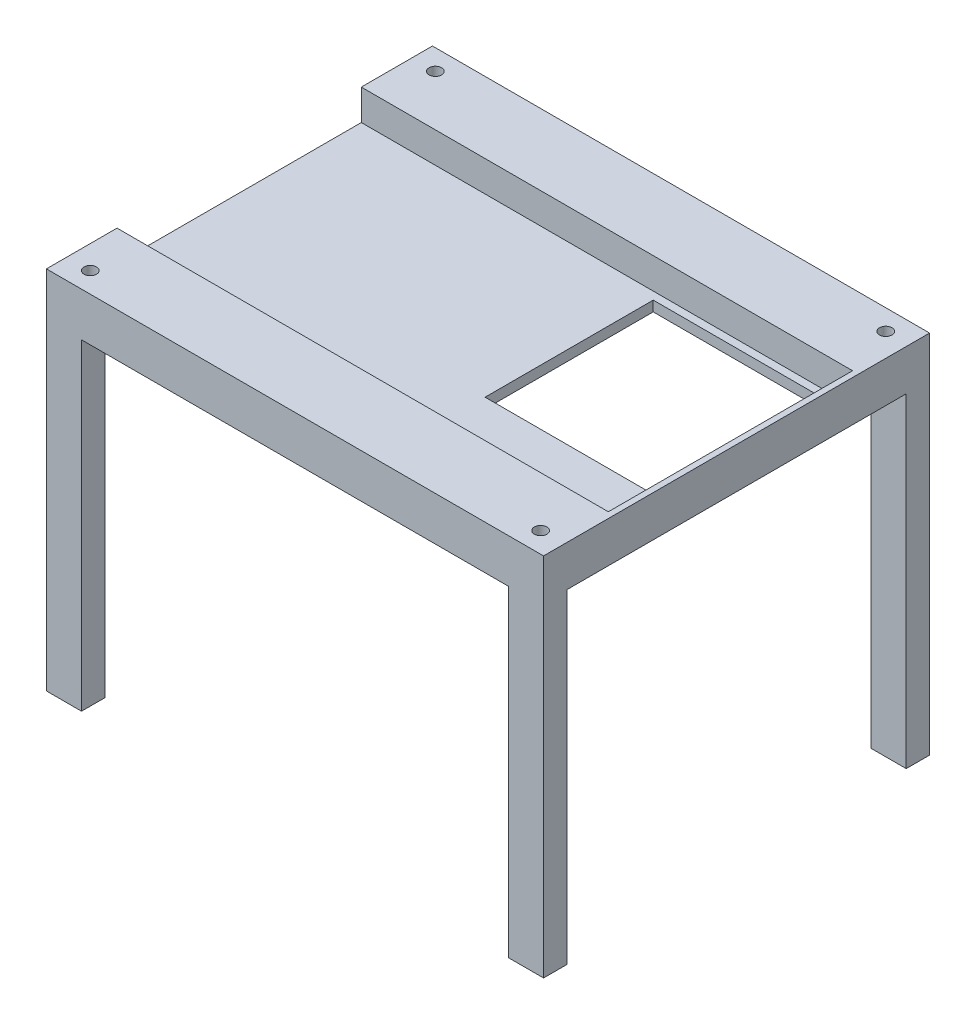
from build123d import *

# Parameters (mm, degrees)
SKETCH1_9_W                                = 170
SKETCH1_9_H                                = 87
BOSS_EXTRUDE5_DEPTH                        = 2
SKETCH1_10_W                               = 63
SKETCH1_10_H                               = 78
CUT_EXTRUDE3_DEPTH                         = 9
SKETCH1_12_W                               = 170
SKETCH1_12_H                               = 87
BOSS_EXTRUDE6_DEPTH                        = 14
SKETCH1_W                                  = 63
SKETCH1_H                                  = 78
CUT_EXTRUDE4_DEPTH                         = 29
SKETCH8_W                                  = 83.526029731
SKETCH8_H                                  = 10.5
CUT_EXTRUDE5_DEPTH                         = 168
BOSS_EXTRUDE10_DEPTH                       = 22.5
CHAMFER1_SIZE                              = 10
CHAMFER2_SIZE                              = 10
SKETCH47_R                                 = 2.15
CUT_EXTRUDE10_DEPTH                        = 9.5
SKETCH37_W                                 = 170
SKETCH37_H                                 = 9
BOSS_EXTRUDE20_DEPTH                       = 5
SKETCH25_W                                 = 170
SKETCH25_H                                 = 8
BOSS_EXTRUDE18_DEPTH                       = 120
SKETCH28_W                                 = 170
SKETCH28_H                                 = 8
BOSS_EXTRUDE19_DEPTH                       = 120
SKETCH43_W                                 = 146
SKETCH43_H                                 = 110
CUT_EXTRUDE9_DEPTH                         = 170.5
SKETCH42_W                                 = 63
SKETCH42_H                                 = 3.5
BOSS_EXTRUDE22_DEPTH                       = 20.5
SKETCH38_W                                 = 5
SKETCH38_H                                 = 9
BOSS_EXTRUDE23_DEPTH                       = 9.5
MIRROR14_AT_THE_SECOND_PLANE_COPY_1_SKET_W = 5
MIRROR14_AT_THE_SECOND_PLANE_COPY_1_SKET_H = 9
MIRROR14_AT_THE_SECOND_PLANE_COPY_1_DEPTH  = 9.5


with BuildPart() as part:
    # Sketch1<9> → Boss-Extrude5 (new body)
    with BuildSketch(Plane(origin=(0, 0, 0), x_dir=(1, 0, 0), z_dir=(0, 1, 0))):
        with Locations((82.5, 41)):
            Rectangle(SKETCH1_9_W, SKETCH1_9_H)
    extrude(amount=BOSS_EXTRUDE5_DEPTH)

    # Sketch1<10> → Cut-Extrude3 (cut)
    with BuildSketch(Plane(origin=(0, 0, 0), x_dir=(1, 0, 0), z_dir=(0, 1, 0))):
        with Locations((131.5, 41)):
            Rectangle(SKETCH1_10_W, SKETCH1_10_H)
    extrude(amount=CUT_EXTRUDE3_DEPTH, mode=Mode.SUBTRACT)

    # Sketch1<12> → Boss-Extrude6 (add)
    with BuildSketch(Plane(origin=(0, 0, 0), x_dir=(1, 0, 0), z_dir=(0, 1, 0))):
        with Locations((82.5, 41)):
            Rectangle(SKETCH1_12_W, SKETCH1_12_H)
    extrude(amount=BOSS_EXTRUDE6_DEPTH)

    # Sketch1 → Cut-Extrude4 (cut)
    with BuildSketch(Plane(origin=(0, 0, 0), x_dir=(1, 0, 0), z_dir=(0, 1, 0))):
        with Locations((131.5, 41)):
            Rectangle(SKETCH1_W, SKETCH1_H)
    extrude(amount=CUT_EXTRUDE4_DEPTH, mode=Mode.SUBTRACT)

    # Sketch8 → Cut-Extrude5 (cut)
    with BuildSketch(Plane.ZY.offset(2.5)):
        with Locations((-40.910699185, 8.75)):
            Rectangle(SKETCH8_W, SKETCH8_H)
    extrude(amount=-CUT_EXTRUDE5_DEPTH, mode=Mode.SUBTRACT)

    # Sketch11 → Boss-Extrude10 (add)
    with BuildSketch(Plane.XY.offset(2.5)):
        Polygon((-2.5, 14), (90, 14), (167.5, 14), (167.5, 9), (90, 9), (-2.5, 9), align=None)
    boss_extrude10 = extrude(amount=BOSS_EXTRUDE10_DEPTH)

    # Mirror10: Boss-Extrude10 across plane
    add(boss_extrude10.mirror(Plane.XY.offset(-41)))

    # Chamfer1
    # the kernel refuses this chamfer: 10 mm, written as the material it adds along each edge
    with BuildSketch(Plane(origin=(-2.5, 9, 2.5), x_dir=(0, -0.9996219169112968, -0.02749587661058636), z_dir=(1, 0, 0))) as chamfer1_piece_1_section:
        Polygon((CHAMFER1_SIZE * 0.999621916911, -CHAMFER1_SIZE * 0.0274958766106), (-CHAMFER1_SIZE * 0.0274958766106, -CHAMFER1_SIZE * 0.999621916911), (0, 0), align=None)
    chamfer1_piece_1 = extrude(amount=170, mode=Mode.PRIVATE)
    chamfer1_piece_1 = split(chamfer1_piece_1, bisect_by=Plane(origin=(82.5, 0, 5.859007471), z_dir=(0, 1, 0)), keep=Keep.TOP, mode=Mode.PRIVATE)
    add(chamfer1_piece_1)

    # Chamfer2
    # the kernel refuses this chamfer: 10 mm, written as the material it adds along each edge
    with BuildSketch(Plane(origin=(-2.5, 9, -84.5), x_dir=(0, 0.027495876610586317, -0.9996219169112968), z_dir=(1, 0, 0))) as chamfer2_piece_1_section:
        Polygon((CHAMFER2_SIZE * 0.999621916911, -CHAMFER2_SIZE * 0.0274958766106), (-CHAMFER2_SIZE * 0.0274958766106, -CHAMFER2_SIZE * 0.999621916911), (0, 0), align=None)
    chamfer2_piece_1 = extrude(amount=170, mode=Mode.PRIVATE)
    chamfer2_piece_1 = split(chamfer2_piece_1, bisect_by=Plane(origin=(82.5, 0, -87.859007471), z_dir=(0, 1, 0)), keep=Keep.TOP, mode=Mode.PRIVATE)
    add(chamfer2_piece_1)

    # Sketch47 → Cut-Extrude10 (cut)
    with BuildSketch(Plane(origin=(0, 14, 0), x_dir=(1, 0, 0), z_dir=(0, 1, 0))):
        with Locations(Location((5.5, 100, 0), (0, 0, 270))):
            Circle(SKETCH47_R)
        with Locations(Location((159.5, 100, 0), (0, 0, 270))):
            Circle(SKETCH47_R)
        with Locations(Location((159.5, -18, 0), (0, 0, 90))):
            Circle(SKETCH47_R)
        with Locations(Location((5.5, -18, 0), (0, 0, 90))):
            Circle(SKETCH47_R)
    extrude(amount=-CUT_EXTRUDE10_DEPTH, mode=Mode.SUBTRACT)

    # Sketch37 → Boss-Extrude20 (add)
    with BuildSketch(Plane.XY.offset(2.5)):
        with Locations((82.5, 4.5)):
            Rectangle(SKETCH37_W, SKETCH37_H)
    boss_extrude20 = extrude(amount=BOSS_EXTRUDE20_DEPTH)

    # Sketch25 → Boss-Extrude18 (add)
    with BuildSketch(Plane.XZ.offset(-9)):
        with Locations((82.5, -103)):
            Rectangle(SKETCH25_W, SKETCH25_H)
    extrude(amount=BOSS_EXTRUDE18_DEPTH)

    # Sketch28 → Boss-Extrude19 (add)
    with BuildSketch(Plane.XZ.offset(-9)):
        with Locations((82.5, 21)):
            Rectangle(SKETCH28_W, SKETCH28_H)
    extrude(amount=BOSS_EXTRUDE19_DEPTH)

    # Mirror11: Boss-Extrude20 across plane
    add(boss_extrude20.mirror(Plane.XY.offset(-41)))

    # Sketch43 → Cut-Extrude9 (cut)
    with BuildSketch(Plane.XY.offset(25)):
        with Locations((82.5, -56)):
            Rectangle(SKETCH43_W, SKETCH43_H)
    extrude(amount=-CUT_EXTRUDE9_DEPTH, mode=Mode.SUBTRACT)

    # Sketch42 → Boss-Extrude22 (add)
    with BuildSketch(Plane(origin=(0, 0, -2), x_dir=(-1, 0, 0), z_dir=(0, 0, -1))):
        with Locations((-131.5, 1.75)):
            Rectangle(SKETCH42_W, SKETCH42_H)
    extrude(amount=BOSS_EXTRUDE22_DEPTH)

    # Sketch38 → Boss-Extrude23 (add)
    with BuildSketch(Plane.XY.offset(7.5)):
        with Locations((0, 4.5)):
            Rectangle(SKETCH38_W, SKETCH38_H)
    boss_extrude23 = extrude(amount=BOSS_EXTRUDE23_DEPTH)

    # Mirror14: Boss-Extrude23 across plane
    add(boss_extrude23.mirror(Plane.XY.offset(-41)))

    # Mirror14 at the second plane: Boss-Extrude23 across plane
    add(boss_extrude23.mirror(Plane.ZY.offset(-82.5)))

    # Mirror14 at the second plane copy 1 sket → Mirror14 at the second plane copy 1 (add)
    with BuildSketch(Plane(origin=(165, 0, -89.5), x_dir=(-1, 0, 0), z_dir=(0, 0, -1))):
        with Locations((0, 4.5)):
            Rectangle(MIRROR14_AT_THE_SECOND_PLANE_COPY_1_SKET_W, MIRROR14_AT_THE_SECOND_PLANE_COPY_1_SKET_H)
    extrude(amount=MIRROR14_AT_THE_SECOND_PLANE_COPY_1_DEPTH)


solid = part.part
